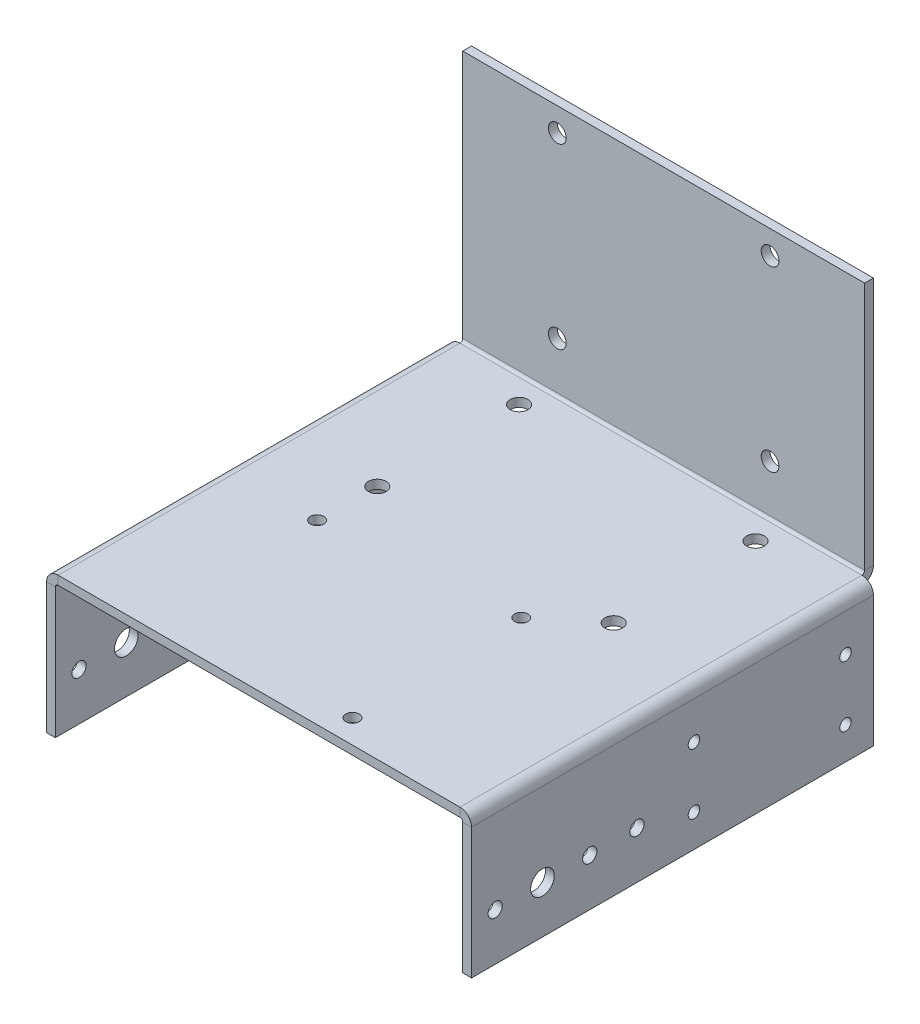
from build123d import *

# Parameters (mm, degrees)
BASE_FLANGE2_DEPTH     = 2.3622
SKETCHED_START         = -95.25
SKETCHED_BEND2_DEPTH   = 107.95
SKETCHED_BEND2_2_DEPTH = 107.95
SKETCHED_START_2       = 38.1
SKETCHED_BEND3_DEPTH   = 107.95
SKETCHED_BEND3_2_DEPTH = 107.95
SKETCH15_R             = 3.175
SKETCH15_R_2           = 1.905
SKETCH15_R_3           = 1.55
CUT_EXTRUDE1_DEPTH     = 166.131598701
SKETCH16_R             = 2.38125
CUT_EXTRUDE2_DEPTH     = 197.530978228
CUT_EXTRUDE3_REACH     = 193.008
SKETCH18_R             = 2.38125
SKETCH18_R_2           = 1.79959


# Read off the part's stored shape, not the designer's step: Sketched Bend2, Sketched Bend3
# Sheet-metal steps are written as plain solids
with BuildPart() as part:
    # Sketch7 → Base-Flange2 (new body)
    with BuildSketch(Plane(origin=(0, 0, 0), x_dir=(1, 0, 0), z_dir=(0, 1, 0))):
        Polygon((38.1, 95.25), (38.1, 165.1), (146.05, 165.1), (146.05, 95.25), (184.15, 95.25), (184.15, -12.7), (0, -12.7), (0, 95.25), align=None)
    extrude(amount=-BASE_FLANGE2_DEPTH)

    # Sketched Bend2 outline → Sketched Bend2 (cut)
    with BuildSketch(Plane.XY.offset(SKETCHED_START)):
        with BuildLine():
            Line((0, -2.3622), (35.090019621, -2.3622))
            ThreePointArc((35.090019621, -2.3622), (36.186889266, -0.661061548), (38.1, 0))
            Line((38.1, 0), (0, 0))
            Line((0, 0), (0, -2.3622))
        make_face()
        with BuildLine():
            ThreePointArc((146.05, 0), (147.963110734, -0.661061548), (149.059980379, -2.3622))
            Line((149.059980379, -2.3622), (184.15, -2.3622))
            Line((184.15, -2.3622), (184.15, 0))
            Line((184.15, 0), (146.05, 0))
        make_face()
    extrude(amount=SKETCHED_BEND2_DEPTH, mode=Mode.SUBTRACT)

    # Sketched Bend2 2 outline → Sketched Bend2 2 (add)
    with BuildSketch(Plane.XY.offset(SKETCHED_START)):
        with BuildLine():
            Line((37.3634, -38.186483884), (37.3634, -3.0988))
            ThreePointArc((37.3634, -3.0988), (37.579145145, -2.577945145), (38.1, -2.3622))
            Line((38.1, -2.3622), (35.090019621, -2.3622))
            ThreePointArc((35.090019621, -2.3622), (35.023485037, -2.727832183), (35.0012, -3.0988))
            Line((35.0012, -3.0988), (35.0012, -38.186483884))
            Line((35.0012, -38.186483884), (37.3634, -38.186483884))
        make_face()
        with BuildLine():
            Line((149.059980379, -2.3622), (146.05, -2.3622))
            ThreePointArc((146.05, -2.3622), (146.570854855, -2.577945145), (146.7866, -3.0988))
            Line((146.7866, -3.0988), (146.7866, -38.186483884))
            Line((146.7866, -38.186483884), (149.1488, -38.186483884))
            Line((149.1488, -38.186483884), (149.1488, -3.0988))
            ThreePointArc((149.1488, -3.0988), (149.126514963, -2.727832183), (149.059980379, -2.3622))
        make_face()
    extrude(amount=SKETCHED_BEND2_2_DEPTH)

    # Sketched Bend3 outline → Sketched Bend3 (cut)
    with BuildSketch(Plane.YZ.offset(SKETCHED_START_2)):
        with BuildLine():
            ThreePointArc((0, -98.259980379), (-1.701138452, -97.163110734), (-2.3622, -95.25))
            Line((-2.3622, -95.25), (-2.3622, -165.1))
            Line((-2.3622, -165.1), (0, -165.1))
            Line((0, -165.1), (0, -98.259980379))
        make_face()
    extrude(amount=SKETCHED_BEND3_DEPTH, mode=Mode.SUBTRACT)

    # Sketched Bend3 2 outline → Sketched Bend3 2 (add)
    with BuildSketch(Plane.YZ.offset(SKETCHED_START_2)):
        with BuildLine():
            Line((0, -95.25), (0, -98.259980379))
            ThreePointArc((0, -98.259980379), (0.365632183, -98.326514963), (0.7366, -98.3488))
            Line((0.7366, -98.3488), (67.574283884, -98.3488))
            Line((67.574283884, -98.3488), (67.574283884, -95.9866))
            Line((67.574283884, -95.9866), (0.7366, -95.9866))
            ThreePointArc((0.7366, -95.9866), (0.215745145, -95.770854855), (0, -95.25))
        make_face()
    extrude(amount=SKETCHED_BEND3_2_DEPTH)

    # Sketch15 → Cut-Extrude1 (cut, through all)
    with BuildSketch(Plane(origin=(149.1488, 0, 0), x_dir=(0, 0, -1), z_dir=(1, 0, 0))):
        with Locations(Location((6.35, -25.486483884, 0), (0, 0, 90))):
            Circle(SKETCH15_R)
        with Locations(Location((19.05, -25.486483884, 0), (0, 0, 90))):
            Circle(SKETCH15_R_2)
        with Locations(Location((31.75, -25.486483884, 0), (0, 0, 90))):
            Circle(SKETCH15_R_2)
        with Locations(Location((-6.35, -25.486483884, 0), (0, 0, 90))):
            Circle(SKETCH15_R_2)
        with Locations(Location((87.75, -13.186483884, 0), (0, 0, 90))):
            Circle(SKETCH15_R_3)
        with Locations(Location((47.05, -29.486483884, 0), (0, 0, 90))):
            Circle(SKETCH15_R_3)
        with Locations(Location((87.75, -29.486483884, 0), (0, 0, 90))):
            Circle(SKETCH15_R_3)
        with Locations(Location((47.05, -13.186483884, 0), (0, 0, 90))):
            Circle(SKETCH15_R_3)
    extrude(amount=-CUT_EXTRUDE1_DEPTH, mode=Mode.SUBTRACT)

    # Sketch16 → Cut-Extrude2 (cut, through all)
    with BuildSketch(Plane.XY.offset(-95.9866)):
        with Locations((63.5, 61.224283884)):
            Circle(SKETCH16_R)
        with Locations((120.65, 61.224283884)):
            Circle(SKETCH16_R)
        with Locations((63.5, 13.4366)):
            Circle(SKETCH16_R)
        with Locations((120.65, 13.4366)):
            Circle(SKETCH16_R)
    extrude(amount=-CUT_EXTRUDE2_DEPTH, mode=Mode.SUBTRACT)

    # Sketch18 → Cut-Extrude3 (cut, up to next)
    with BuildSketch(Plane(origin=(0, 0, 0), x_dir=(1, 0, 0), z_dir=(0, 1, 0)), mode=Mode.PRIVATE) as cut_extrude3_sk1:
        with Locations(Location((60.325, 88.9, 0), (0, 0, 270))):
            Circle(SKETCH18_R)
    cut_extrude3_tool1 = extrude(cut_extrude3_sk1.sketch, amount=-CUT_EXTRUDE3_REACH, mode=Mode.PRIVATE) & part.part
    # Sketch18 → Cut-Extrude3 (cut, up to next)
    with BuildSketch(Plane(origin=(0, 0, 0), x_dir=(1, 0, 0), z_dir=(0, 1, 0)), mode=Mode.PRIVATE) as cut_extrude3_sk2:
        with Locations(Location((123.825, 88.9, 0), (0, 0, 270))):
            Circle(SKETCH18_R)
    cut_extrude3_tool2 = extrude(cut_extrude3_sk2.sketch, amount=-CUT_EXTRUDE3_REACH, mode=Mode.PRIVATE) & part.part
    # Sketch18 → Cut-Extrude3 (cut, up to next)
    with BuildSketch(Plane(origin=(0, 0, 0), x_dir=(1, 0, 0), z_dir=(0, 1, 0)), mode=Mode.PRIVATE) as cut_extrude3_sk3:
        with Locations(Location((60.325, 50.8, 0), (0, 0, 270))):
            Circle(SKETCH18_R)
    cut_extrude3_tool3 = extrude(cut_extrude3_sk3.sketch, amount=-CUT_EXTRUDE3_REACH, mode=Mode.PRIVATE) & part.part
    # Sketch18 → Cut-Extrude3 (cut, up to next)
    with BuildSketch(Plane(origin=(0, 0, 0), x_dir=(1, 0, 0), z_dir=(0, 1, 0)), mode=Mode.PRIVATE) as cut_extrude3_sk4:
        with Locations(Location((123.825, 50.8, 0), (0, 0, 270))):
            Circle(SKETCH18_R)
    cut_extrude3_tool4 = extrude(cut_extrude3_sk4.sketch, amount=-CUT_EXTRUDE3_REACH, mode=Mode.PRIVATE) & part.part
    # Sketch18 → Cut-Extrude3 (cut, up to next)
    with BuildSketch(Plane(origin=(0, 0, 0), x_dir=(1, 0, 0), z_dir=(0, 1, 0)), mode=Mode.PRIVATE) as cut_extrude3_sk5:
        with Locations(Location((60.09894, 34.86658, 0), (0, 0, 270))):
            Circle(SKETCH18_R_2)
    cut_extrude3_tool5 = extrude(cut_extrude3_sk5.sketch, amount=-CUT_EXTRUDE3_REACH, mode=Mode.PRIVATE) & part.part
    # Sketch18 → Cut-Extrude3 (cut, up to next)
    with BuildSketch(Plane(origin=(0, 0, 0), x_dir=(1, 0, 0), z_dir=(0, 1, 0)), mode=Mode.PRIVATE) as cut_extrude3_sk6:
        with Locations(Location((110.20552, 39.59352, 0), (0, 0, 270))):
            Circle(SKETCH18_R_2)
    cut_extrude3_tool6 = extrude(cut_extrude3_sk6.sketch, amount=-CUT_EXTRUDE3_REACH, mode=Mode.PRIVATE) & part.part
    # Sketch18 → Cut-Extrude3 (cut, up to next)
    with BuildSketch(Plane(origin=(0, 0, 0), x_dir=(1, 0, 0), z_dir=(0, 1, 0)), mode=Mode.PRIVATE) as cut_extrude3_sk7:
        with Locations(Location((110.8202, -6.35, 0), (0, 0, 270))):
            Circle(SKETCH18_R_2)
    cut_extrude3_tool7 = extrude(cut_extrude3_sk7.sketch, amount=-CUT_EXTRUDE3_REACH, mode=Mode.PRIVATE) & part.part
    add(cut_extrude3_tool1.solids().sort_by_distance((60.325, 0, -88.9))[0], mode=Mode.SUBTRACT)
    add(cut_extrude3_tool2.solids().sort_by_distance((123.825, 0, -88.9))[0], mode=Mode.SUBTRACT)
    add(cut_extrude3_tool3.solids().sort_by_distance((60.325, 0, -50.8))[0], mode=Mode.SUBTRACT)
    add(cut_extrude3_tool4.solids().sort_by_distance((123.825, 0, -50.8))[0], mode=Mode.SUBTRACT)
    add(cut_extrude3_tool5.solids().sort_by_distance((60.09894, 0, -34.86658))[0], mode=Mode.SUBTRACT)
    add(cut_extrude3_tool6.solids().sort_by_distance((110.20552, 0, -39.59352))[0], mode=Mode.SUBTRACT)
    add(cut_extrude3_tool7.solids().sort_by_distance((110.8202, 0, 6.35))[0], mode=Mode.SUBTRACT)


solid = part.part
